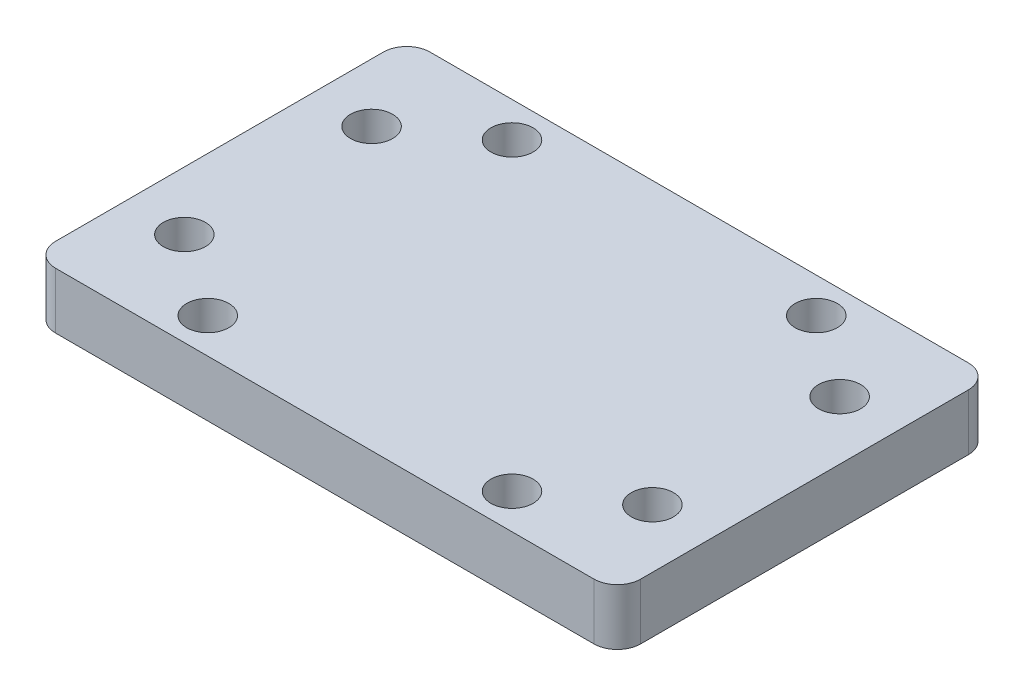
from build123d import *

# Parameters (mm, degrees)
SZKIC1_W                    = 125
SZKIC1_H                    = 80
DODANIE_WYCI_GNI_CIE1_DEPTH = 12
ZAOKR_GLENIE1_R             = 5
OTW_R_POD_RUB_M81_D         = 9
OTW_R_POD_RUB_M81_DEPTH     = 16
OTW_R_POD_RUB_M81_TIP       = 2.703872786
OTW_R_POD_RUB_M82_D         = 9
OTW_R_POD_RUB_M82_DEPTH     = 16
OTW_R_POD_RUB_M82_TIP       = 2.703872786
SZKIC8_R                    = 10
WYTNIJ_WYCI_GNI_CIE1_DEPTH  = 1.5
ZAOKR_GLENIE2_R             = 1.5


with BuildPart() as part:
    # Szkic1 → Dodanie-wyciągnięcie1 (new body)
    with BuildSketch(Plane(origin=(0, 0, 0), x_dir=(1, 0, 0), z_dir=(0, 1, 0))):
        Rectangle(SZKIC1_W, SZKIC1_H)
    extrude(amount=DODANIE_WYCI_GNI_CIE1_DEPTH)

    # Zaokrąglenie1
    zaokr_glenie1_edges = [part.edges().sort_by_distance(p)[0] for p in [
        (62.5, 6, 40),
        (-62.5, 6, 40),
        (-62.5, 6, -40),
        (62.5, 6, -40),
    ]]
    fillet(zaokr_glenie1_edges, radius=ZAOKR_GLENIE1_R)

    # Otwór pod śrubę M81
    with Locations(Plane(origin=(0, 12, 0), x_dir=(1, 0, 0), z_dir=(0, 1, 0))):
        with Locations((-50, 20), (50, 20), (50, -20), (-50, -20)):
            Hole(OTW_R_POD_RUB_M81_D / 2, depth=OTW_R_POD_RUB_M81_DEPTH)
            with Locations((0, 0, -(OTW_R_POD_RUB_M81_DEPTH + OTW_R_POD_RUB_M81_TIP / 2))):  # 118° drill point
                Cone(0, OTW_R_POD_RUB_M81_D / 2, OTW_R_POD_RUB_M81_TIP, mode=Mode.SUBTRACT)

    # Otwór pod śrubę M82
    with Locations(Plane(origin=(0, 12, 0), x_dir=(1, 0, 0), z_dir=(0, 1, 0))):
        with Locations((-32.5, 32.5), (32.5, 32.5), (32.5, -32.5), (-32.5, -32.5)):
            Hole(OTW_R_POD_RUB_M82_D / 2, depth=OTW_R_POD_RUB_M82_DEPTH)
            with Locations((0, 0, -(OTW_R_POD_RUB_M82_DEPTH + OTW_R_POD_RUB_M82_TIP / 2))):  # 118° drill point
                Cone(0, OTW_R_POD_RUB_M82_D / 2, OTW_R_POD_RUB_M82_TIP, mode=Mode.SUBTRACT)

    # Szkic8 → Wytnij-wyciągnięcie1 (cut)
    with BuildSketch(Plane.XZ):
        with Locations(Location((0, 0, 0), (0, 0, 270))):
            Circle(SZKIC8_R)
    extrude(amount=-WYTNIJ_WYCI_GNI_CIE1_DEPTH, mode=Mode.SUBTRACT)

    # Zaokrąglenie2
    zaokr_glenie2_edges = [part.edges().sort_by_distance(p)[0] for p in [
        (0, 1.5, 10),
    ]]
    fillet(zaokr_glenie2_edges, radius=ZAOKR_GLENIE2_R - 0.0001)  # a hair under: the kernel refuses the full size


solid = part.part
